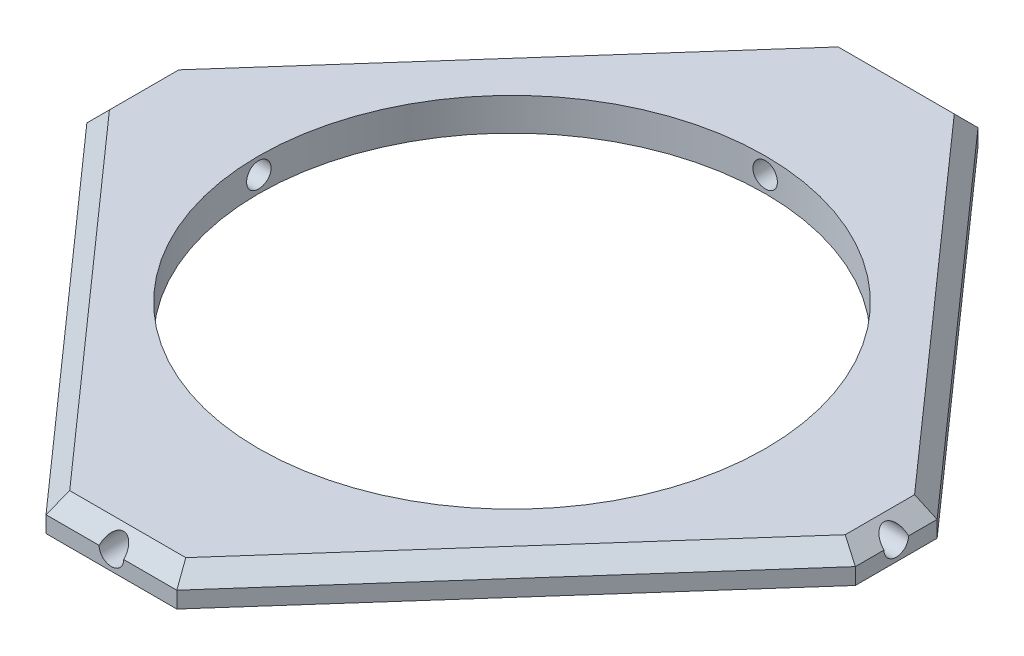
from build123d import *

# Parameters (mm, degrees)
BOSS_EXTRUDE1_DEPTH = 20
SKETCH2_R           = 7.5
CUT_EXTRUDE1_DEPTH  = 544.806031596
SKETCH3_R           = 7.5
CUT_EXTRUDE2_DEPTH  = 531.400791855
CHAMFER1_SIZE       = 10
SKETCH4_R           = 155
CUT_EXTRUDE3_DEPTH  = 341.073521463


with BuildPart() as part:
    # Sketch1 → Boss-Extrude1 (new body)
    with BuildSketch(Plane(origin=(0, 0, 0), x_dir=(1, 0, 0), z_dir=(0, 1, 0))):
        Polygon((-235, 25), (-40, 245), (40, 245), (235, 25), (235, -25), (40, -245), (-40, -245), (-235, -25), align=None)
    extrude(amount=BOSS_EXTRUDE1_DEPTH)

    # Sketch2 → Cut-Extrude1 (cut, through all)
    with BuildSketch(Plane.XY.offset(245)):
        with Locations((0, 10)):
            Circle(SKETCH2_R)
    extrude(amount=-CUT_EXTRUDE1_DEPTH, mode=Mode.SUBTRACT)

    # Sketch3 → Cut-Extrude2 (cut, through all)
    with BuildSketch(Plane(origin=(235, 0, 0), x_dir=(0, 0, -1), z_dir=(1, 0, 0))):
        with Locations((0, 10)):
            Circle(SKETCH3_R)
    extrude(amount=-CUT_EXTRUDE2_DEPTH, mode=Mode.SUBTRACT)

    # Chamfer1
    # the kernel refuses this chamfer: 10 mm, written as the material it takes off along each edge
    with BuildSketch(Plane(origin=(-235, 20, 50.71682988), x_dir=(-0.0274958766105877, -0.9996219169112968, 0), z_dir=(0, 0, -1))) as chamfer1_piece_1:
        Polygon((CHAMFER1_SIZE * 0.999621916911, -CHAMFER1_SIZE * 0.0274958766106), (-CHAMFER1_SIZE * 0.0274958766106, -CHAMFER1_SIZE * 0.999621916911), (0, 0), align=None)
    extrude(amount=101.433659759, mode=Mode.SUBTRACT)
    with BuildSketch(Plane(origin=(-22.941833496, 20, 264.245110927), x_dir=(0.7480640019059354, 0.02749587661058627, -0.6630567289620791), z_dir=(-0.6633075143158518, 0, -0.7483469392281404)), Plane(origin=(252.058166504, 20, 5.754889073), x_dir=(-0.7480640019059355, 0.02749587661058636, -0.6630567289620791), z_dir=(-0.6633075143158518, 0, 0.7483469392281404)), Plane(origin=(22.941833496, 20, -264.245110927), x_dir=(-0.7480640019059354, 0.02749587661058627, 0.6630567289620791), z_dir=(0.6633075143158519, 0, 0.7483469392281404))) as chamfer1_piece_2:
        Polygon((CHAMFER1_SIZE * 0.999621916911, CHAMFER1_SIZE * 0.0274958766106), (-CHAMFER1_SIZE * 0.0274958766106, CHAMFER1_SIZE * 0.999621916911), (0, 0), align=None)
    extrude(amount=345.414951681, mode=Mode.SUBTRACT)
    with BuildSketch(Plane(origin=(65.71682988, 20, 245), x_dir=(0, 0.027495876610586282, -0.9996219169112968), z_dir=(-1, 0, 0))) as chamfer1_piece_3:
        Polygon((CHAMFER1_SIZE * 0.999621916911, CHAMFER1_SIZE * 0.0274958766106), (-CHAMFER1_SIZE * 0.0274958766106, CHAMFER1_SIZE * 0.999621916911), (0, 0), align=None)
    extrude(amount=131.433659759, mode=Mode.SUBTRACT)
    with BuildSketch(Plane(origin=(235, 20, -50.71682988), x_dir=(-0.9996219169112968, 0.027495876610586282, 0), z_dir=(0, 0, 1))) as chamfer1_piece_4:
        Polygon((CHAMFER1_SIZE * 0.999621916911, CHAMFER1_SIZE * 0.0274958766106), (-CHAMFER1_SIZE * 0.0274958766106, CHAMFER1_SIZE * 0.999621916911), (0, 0), align=None)
    extrude(amount=101.433659759, mode=Mode.SUBTRACT)
    with BuildSketch(Plane(origin=(-65.71682988, 20, -245), x_dir=(0, -0.9996219169112968, -0.0274958766105877), z_dir=(1, 0, 0))) as chamfer1_piece_5:
        Polygon((CHAMFER1_SIZE * 0.999621916911, -CHAMFER1_SIZE * 0.0274958766106), (-CHAMFER1_SIZE * 0.0274958766106, -CHAMFER1_SIZE * 0.999621916911), (0, 0), align=None)
    extrude(amount=131.433659759, mode=Mode.SUBTRACT)
    with BuildSketch(Plane(origin=(-252.058166504, 20, -5.754889073), x_dir=(-0.020576455102926446, -0.9996219169112968, -0.018238221568502983), z_dir=(0.6633075143158518, 0, -0.7483469392281404))) as chamfer1_piece_6:
        Polygon((CHAMFER1_SIZE * 0.999621916911, -CHAMFER1_SIZE * 0.0274958766106), (-CHAMFER1_SIZE * 0.0274958766106, -CHAMFER1_SIZE * 0.999621916911), (0, 0), align=None)
    extrude(amount=345.414951681, mode=Mode.SUBTRACT)

    # Sketch4 → Cut-Extrude3 (cut, through all)
    with BuildSketch(Plane(origin=(0, 20, 0), x_dir=(1, 0, 0), z_dir=(0, 1, 0))):
        with Locations(Location((0, 0, 0), (0, 0, 270))):
            Circle(SKETCH4_R)
    extrude(amount=-CUT_EXTRUDE3_DEPTH, mode=Mode.SUBTRACT)


solid = part.part
